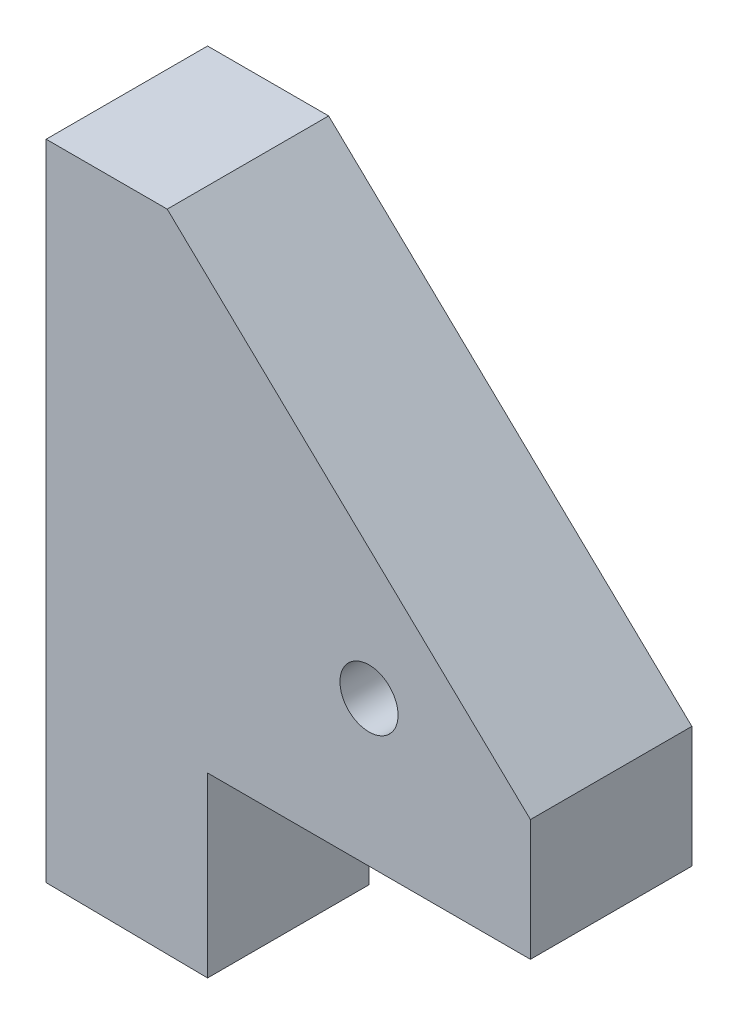
from build123d import *

# Parameters (mm, degrees)
BOSS_EXTRUDE1_DEPTH = 12.7
SKETCH5_R           = 1.905
CUT_EXTRUDE3_DEPTH  = 12.7
SKETCH8_R           = 2.286
CUT_EXTRUDE6_DEPTH  = 55.4917324


with BuildPart() as part:
    # Sketch1 → Boss-Extrude1 (new body)
    with BuildSketch(Plane.XY):
        Polygon((-25.4, 0), (0, 0), (0, 9.525), (-28.575, 36.83), (-38.1, 36.83), (-38.1, -13.823553391), (-25.4, -13.97), align=None)
    extrude(amount=BOSS_EXTRUDE1_DEPTH)

    # Sketch5 → Cut-Extrude3 (cut)
    with BuildSketch(Plane.XZ):
        with Locations((-6.35, 6.35)):
            Circle(SKETCH5_R)
        with Locations((-19.05, 6.35)):
            Circle(SKETCH5_R)
    extrude(amount=-CUT_EXTRUDE3_DEPTH, mode=Mode.SUBTRACT)

    # Sketch8 → Cut-Extrude6 (cut, through all)
    with BuildSketch(Plane.XY.offset(12.7)):
        with Locations((-12.7, 11.43)):
            Circle(SKETCH8_R)
    extrude(amount=-CUT_EXTRUDE6_DEPTH, mode=Mode.SUBTRACT)


solid = part.part
